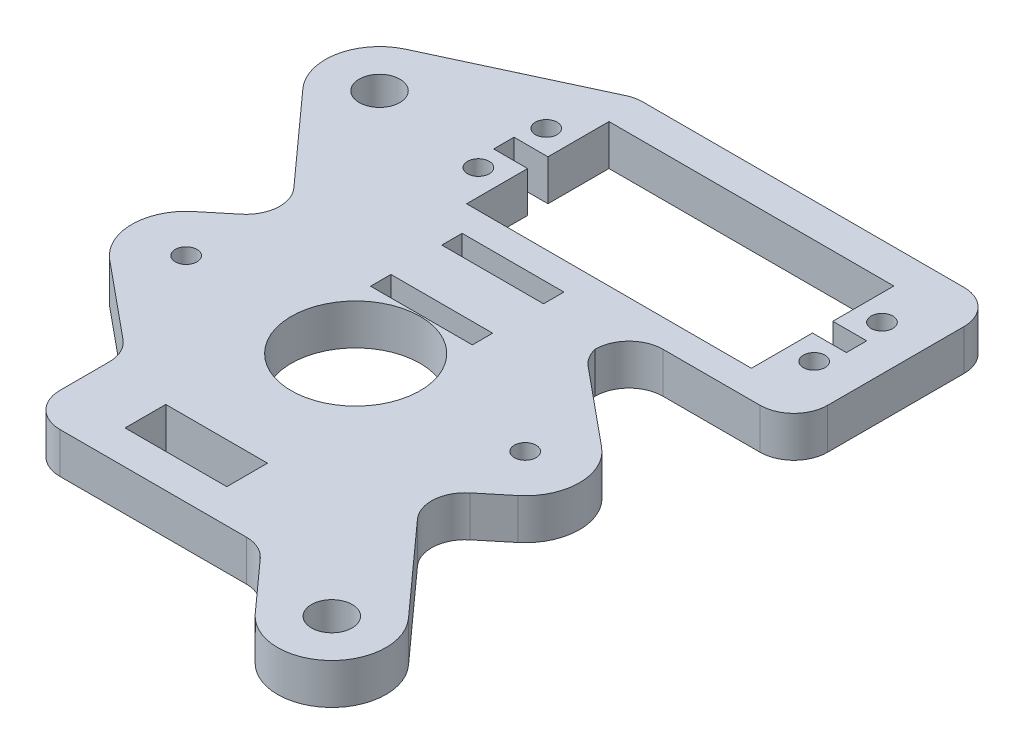
from build123d import *

# Parameters (mm, degrees)
ESBO_O1_R                = 3
ESBO_O1_R_2              = 1.6
ESBO_O1_W                = 15
ESBO_O1_H                = 3
ESBO_O1_W_2              = 42
ESBO_O1_H_2              = 21
ESBO_O1_R_3              = 9.5
ESBO_O1_H_3              = 6
RESSALTO_EXTRUS_O1_DEPTH = 6
FILETE1_R                = 5
ESBO_O2_W                = 15
ESBO_O2_H                = 1.3
ESBO_O2_W_2              = 5
ESBO_O2_H_2              = 3
CORTE_EXTRUS_O1_DEPTH    = 183.363523005
ESBO_O3_W                = 15
ESBO_O3_H                = 1.3
RESSALTO_EXTRUS_O2_DEPTH = 6


with BuildPart() as part:
    # Esboço1 → Ressalto-extrusão1 (new body)
    with BuildSketch(Plane.XZ.offset(6)):
        with BuildLine():
            ThreePointArc((28.221137594, -123.946334359), (26.32780231, -130.898758331), (30.793557575, -136.55366306))
            Line((30.793557575, -136.55366306), (52.89462836, -146.829127406))
            ThreePointArc((52.89462836, -146.829127406), (53.923154275, -147.177291613), (55.00259, -147.2952))
            Line((55.00259, -147.2952), (102.35259, -147.2952))
            ThreePointArc((102.35259, -147.2952), (105.888123906, -145.830733906), (107.35259, -142.2952))
            Line((107.35259, -142.2952), (107.35259, -122.2))
            ThreePointArc((107.35259, -122.2), (105.888123906, -118.664466094), (102.35259, -117.2))
            Line((102.35259, -117.2), (88.05, -117.2))
            ThreePointArc((88.05, -117.2), (84.514466094, -115.735533906), (83.05, -112.2))
            Line((83.05, -112.2), (83.05, -110.8795617))
            Line((83.05, -110.8795617), (96.038503575, -100.173097388))
            ThreePointArc((96.038503575, -100.173097388), (98.95, -94), (96.038503575, -87.826902612))
            Line((96.038503575, -87.826902612), (88.137508625, -81.314087647))
            Line((88.137508625, -81.314087647), (103.678862406, -64.053665641))
            ThreePointArc((103.678862406, -64.053665641), (103.086748653, -52.755462186), (91.788545198, -53.347575939))
            Line((91.788545198, -53.347575939), (85.037246259, -60.845653032))
            ThreePointArc((85.037246259, -60.845653032), (83.355205347, -62.067727288), (81.321522132, -62.5))
            Line((81.321522132, -62.5), (53.85, -62.5))
            ThreePointArc((53.85, -62.5), (50.314466094, -63.964466094), (48.85, -67.5))
            Line((48.85, -67.5), (48.85, -77.1204383))
            Line((48.85, -77.1204383), (35.861496425, -87.826902612))
            ThreePointArc((35.861496425, -87.826902612), (32.95, -94), (35.861496425, -100.173097388))
            Line((35.861496425, -100.173097388), (43.762491375, -106.685912353))
            Line((43.762491375, -106.685912353), (28.221137594, -123.946334359))
        make_face()
        with Locations(Location((34.166296198, -129.29937921, 0), (0, 0, 270))):
            Circle(ESBO_O1_R, mode=Mode.SUBTRACT)
        with Locations(Location((51.25259, -136.7952, 0), (0, 0, 270))):
            Circle(ESBO_O1_R_2, mode=Mode.SUBTRACT)
        with Locations(Location((51.25259, -126.7952, 0), (0, 0, 270))):
            Circle(ESBO_O1_R_2, mode=Mode.SUBTRACT)
        with Locations((65.95, -115.7)):
            Rectangle(ESBO_O1_W, ESBO_O1_H, mode=Mode.SUBTRACT)
        with Locations((65.95, -106.5)):
            Rectangle(ESBO_O1_W, ESBO_O1_H, mode=Mode.SUBTRACT)
        with Locations((76.00259, -131.7952)):
            Rectangle(ESBO_O1_W_2, ESBO_O1_H_2, mode=Mode.SUBTRACT)
        with Locations(Location((100.75259, -136.7952, 0), (0, 0, 270))):
            Circle(ESBO_O1_R_2, mode=Mode.SUBTRACT)
        with Locations(Location((100.75259, -126.7952, 0), (0, 0, 270))):
            Circle(ESBO_O1_R_2, mode=Mode.SUBTRACT)
        with Locations(Location((65.95, -94, 0), (0, 0, 270))):
            Circle(ESBO_O1_R_3, mode=Mode.SUBTRACT)
        with Locations((65.95, -70.5)):
            Rectangle(ESBO_O1_W, ESBO_O1_H_3, mode=Mode.SUBTRACT)
        with Locations(Location((97.733703802, -58.70062079, 0), (0, 0, 270))):
            Circle(ESBO_O1_R, mode=Mode.SUBTRACT)
        with Locations(Location((40.95, -94, 0), (0, 0, 270))):
            Circle(ESBO_O1_R_2, mode=Mode.SUBTRACT)
        with Locations(Location((90.95, -94, 0), (0, 0, 270))):
            Circle(ESBO_O1_R_2, mode=Mode.SUBTRACT)
    extrude(amount=-RESSALTO_EXTRUS_O1_DEPTH)

    # Filete1
    # the kernel refuses this fillet: 5 mm, written as the material it adds along each edge
    with BuildSketch(Plane(origin=(83.05, -6, -110.8795617), x_dir=(0, 0, -1), z_dir=(0, 1, 0))) as filete1_piece_1:
        with BuildLine():
            CenterArc((2.468290902, -4.866460151), FILETE1_R, 103.271787815, 37.229346276)
            Line((-1.389894966, -1.686145417), (-1.467058683, -1.622539122))
            Line((-1.467058683, -1.622539122), (-0.077163717, 0.063606295))
            Line((-0.077163717, 0.063606295), (0, 0.1))
            ThreePointArc((0, 0.1), (0.66021915, 0.1), (1.297481248, 0.097329203))
            Line((1.297481248, 0.097329203), (1.3204383, 0))
        make_face()
    extrude(amount=6)
    with BuildSketch(Plane(origin=(88.137508625, -6, -81.314087647), x_dir=(0.7716371735307594, 0, -0.6360629469049904), z_dir=(0, 1, 0))) as filete1_piece_2:
        with BuildLine():
            CenterArc((FILETE1_R * 1.04463432468, -FILETE1_R), FILETE1_R, 90, 92.501134091)
            Line((FILETE1_R * 0.045586966675, -FILETE1_R * 1.04363916214), (FILETE1_R * 0.025606019515, -FILETE1_R * 1.04451194539))
            Line((FILETE1_R * 0.025606019515, -FILETE1_R * 1.04451194539), (-FILETE1_R * 0.0208926864935, FILETE1_R * 0.02))
            Line((-FILETE1_R * 0.0208926864935, FILETE1_R * 0.02), (FILETE1_R * 1.04463432468, FILETE1_R * 0.02))
            Line((FILETE1_R * 1.04463432468, FILETE1_R * 0.02), (FILETE1_R * 1.04463432468, 0))
        make_face()
    extrude(amount=6)
    with BuildSketch(Plane(origin=(48.85, -6, -77.1204383), x_dir=(0, 0, 1), z_dir=(0, 1, 0))) as filete1_piece_3:
        with BuildLine():
            CenterArc((FILETE1_R * 0.471642717043, -FILETE1_R), FILETE1_R, 90, 50.501134091)
            Line((-FILETE1_R * 0.299994456488, -FILETE1_R * 0.363937053095), (-FILETE1_R * 0.315427199959, -FILETE1_R * 0.351215794157))
            Line((-FILETE1_R * 0.315427199959, -FILETE1_R * 0.351215794157), (-FILETE1_R * 0.00943285434085, FILETE1_R * 0.02))
            Line((-FILETE1_R * 0.00943285434085, FILETE1_R * 0.02), (FILETE1_R * 0.471642717043, FILETE1_R * 0.02))
            Line((FILETE1_R * 0.471642717043, FILETE1_R * 0.02), (FILETE1_R * 0.471642717043, 0))
        make_face()
    extrude(amount=6)
    with BuildSketch(Plane(origin=(43.762491375, -6, -106.685912353), x_dir=(-0.6691306063588565, 0, -0.7431448254773958), z_dir=(0, 1, 0))) as filete1_piece_4:
        with BuildLine():
            CenterArc((FILETE1_R * 1.04463432468, FILETE1_R), FILETE1_R, 177.498865909, 92.501134091)
            Line((FILETE1_R * 0.0455869666753, FILETE1_R * 1.04363916214), (FILETE1_R * 0.0256060195153, FILETE1_R * 1.04451194539))
            Line((FILETE1_R * 0.0256060195153, FILETE1_R * 1.04451194539), (-FILETE1_R * 0.0208926864935, -FILETE1_R * 0.02))
            Line((-FILETE1_R * 0.0208926864935, -FILETE1_R * 0.02), (FILETE1_R * 1.04463432468, -FILETE1_R * 0.02))
            Line((FILETE1_R * 1.04463432468, -FILETE1_R * 0.02), (FILETE1_R * 1.04463432468, 0))
        make_face()
    extrude(amount=6)

    # Esboço2 → Corte-extrusão1 (cut, through all)
    with BuildSketch(Plane.XZ.offset(6)):
        with Locations((65.95, -104.35)):
            Rectangle(ESBO_O2_W, ESBO_O2_H)
        with Locations((52.50259, -131.7952)):
            Rectangle(ESBO_O2_W_2, ESBO_O2_H_2)
        with Locations((99.50259, -131.7952)):
            Rectangle(ESBO_O2_W_2, ESBO_O2_H_2)
    extrude(amount=-CORTE_EXTRUS_O1_DEPTH, mode=Mode.SUBTRACT)

    # Esboço3 → Ressalto-extrusão2 (add)
    with BuildSketch(Plane.XZ.offset(6)):
        with Locations((65.95, -107.35)):
            Rectangle(ESBO_O3_W, ESBO_O3_H)
    extrude(amount=-RESSALTO_EXTRUS_O2_DEPTH)


solid = part.part
